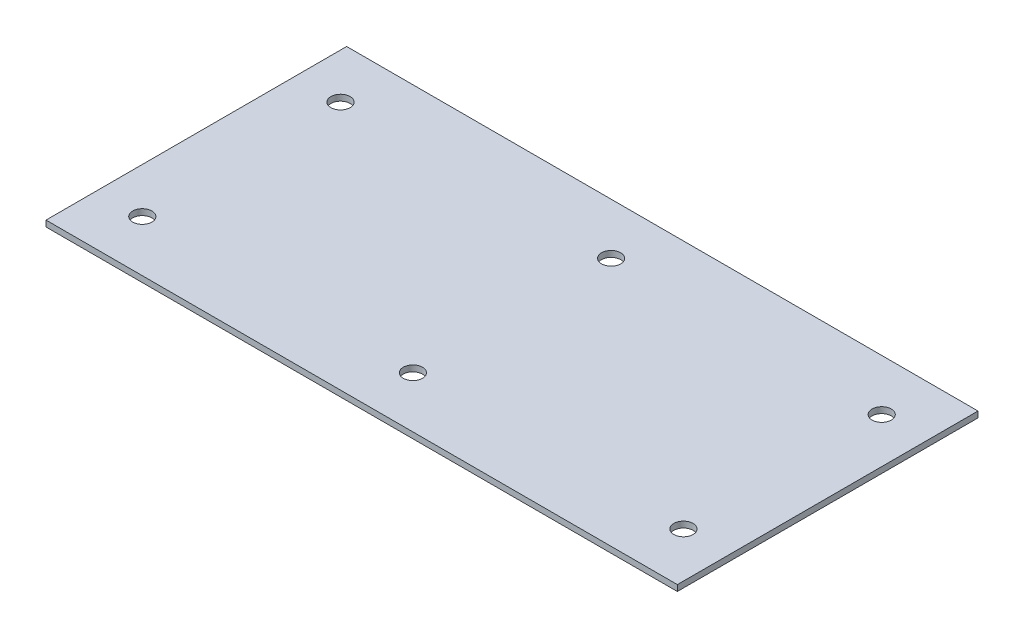
from build123d import *

# Parameters (mm, degrees)
SKETCH_1_W      = 210
SKETCH_1_H      = 100
SKETCH_1_R      = 3.2
EXTRUDE_1_DEPTH = 2


with BuildPart() as part:
    # Эскиз1 → Бобышка-Вытянуть1 (new body)
    with BuildSketch(Plane(origin=(0, 0, 0), x_dir=(1, 0, 0), z_dir=(0, 1, 0))):
        with Locations((105, 50)):
            Rectangle(SKETCH_1_W, SKETCH_1_H)
        with Locations((15, 17.034247801)):
            Circle(SKETCH_1_R, mode=Mode.SUBTRACT)
        with Locations((195, 17.034247801)):
            Circle(SKETCH_1_R, mode=Mode.SUBTRACT)
        with Locations((105, 17.034247801)):
            Circle(SKETCH_1_R, mode=Mode.SUBTRACT)
        with Locations((15, 82.965752199)):
            Circle(SKETCH_1_R, mode=Mode.SUBTRACT)
        with Locations((105, 82.965752199)):
            Circle(SKETCH_1_R, mode=Mode.SUBTRACT)
        with Locations((195, 82.965752199)):
            Circle(SKETCH_1_R, mode=Mode.SUBTRACT)
    extrude(amount=EXTRUDE_1_DEPTH)


solid = part.part
